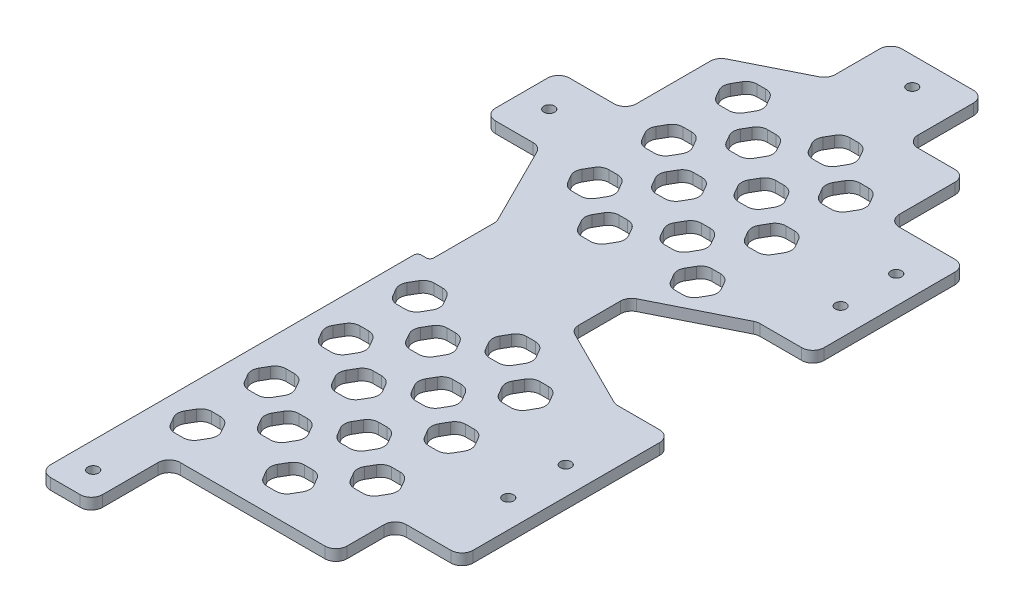
from build123d import *

# Parameters (mm, degrees)
EXTRUDE_1_DEPTH     = 3
FILLET_1_R          = 3
FILLET_2_R          = 1
SKETCH_2_R          = 1.45
CUT_EXTRUDE_1_DEPTH = 119.660324035
CUT_EXTRUDE_2_DEPTH = 119.660324035
FILLET_3_R          = 3


with BuildPart() as part:
    # 草图1 → 凸台-拉伸1 (new body)
    with BuildSketch(Plane(origin=(0, 0, 0), x_dir=(1, 0, 0), z_dir=(0, 1, 0))):
        Polygon((50.15, 65.5), (29.15, 65.5), (29.15, 86.5), (13.15, 86.5), (13.15, 107.5), (-12.15, 107.5), (-12.15, 90.645898034), (-32.15, 80.645898034), (-32.15, 55.854101966), (-50.15, 55.854101966), (-50.15, 35.854101966), (-35.15, 35.854101966), (-23.472949017, 12.5), (-23.472949017, -5.5), (-26.85, -5.5), (-26.85, -107.5), (-12.85, -107.5), (-12.85, -86.5), (32.15, -86.5), (32.15, -70.5), (50.15, -70.5), (50.15, -14.177050983), (35.15, -14.177050983), (11.795898034, -2.5), (11.795898034, 12.5), (35.15, 24.177050983), (50.15, 24.177050983), align=None)
    extrude(amount=EXTRUDE_1_DEPTH)

    # 圆角1
    fillet_1_edges = [part.edges().sort_by_distance(p)[0] for p in [
        (32.15, 1.5, 70.5),
        (-12.85, 1.5, 86.5),
        (-12.85, 1.5, 107.5),
        (-26.85, 1.5, 107.5),
        (-23.472949017, 1.5, -12.5),
        (-35.15, 1.5, -35.854101966),
        (-50.15, 1.5, -35.854101966),
        (-50.15, 1.5, -55.854101966),
        (-12.15, 1.5, -107.5),
        (13.15, 1.5, -107.5),
        (50.15, 1.5, -24.177050983),
        (35.15, 1.5, -24.177050983),
        (11.795898034, 1.5, -12.5),
        (11.795898034, 1.5, 2.5),
        (35.15, 1.5, 14.177050983),
        (50.15, 1.5, 14.177050983),
        (32.15, 1.5, 86.5),
        (50.15, 1.5, 70.5),
        (29.15, 1.5, -86.5),
        (50.15, 1.5, -65.5),
        (-32.15, 1.5, -55.854101966),
        (-32.15, 1.5, -80.645898034),
        (-12.15, 1.5, -90.645898034),
        (13.15, 1.5, -86.5),
        (29.15, 1.5, -65.5),
    ]]
    fillet(fillet_1_edges, radius=FILLET_1_R)

    # 圆角2
    fillet_2_edges = [part.edges().sort_by_distance(p)[0] for p in [
        (-26.85, 1.5, 5.5),
        (-23.472949017, 1.5, 5.5),
    ]]
    fillet(fillet_2_edges, radius=FILLET_2_R)

    # 草图2 → 切除-拉伸1 (cut, through all)
    with BuildSketch(Plane(origin=(0, 3, 0), x_dir=(1, 0, 0), z_dir=(0, 1, 0))):
        with Locations((-19.85, -100)):
            Circle(SKETCH_2_R)
        with Locations((42.65, -50.5)):
            Circle(SKETCH_2_R)
        with Locations((42.65, -35)):
            Circle(SKETCH_2_R)
        with Locations((-42.65, 45.854101966)):
            Circle(SKETCH_2_R)
        with Locations((1.15, 100)):
            Circle(SKETCH_2_R)
        with Locations((42.65, 54.177050983)):
            Circle(SKETCH_2_R)
        with Locations((42.65, 39.177050983)):
            Circle(SKETCH_2_R)
    extrude(amount=-CUT_EXTRUDE_1_DEPTH, mode=Mode.SUBTRACT)

    # 草图3 → 切除-拉伸2 (cut, through all)
    with BuildSketch(Plane(origin=(0, 3, 0), x_dir=(1, 0, 0), z_dir=(0, 1, 0))):
        Polygon((11.483563166, 74.742867255), (8.59681182, 79.742867255), (2.823309128, 79.742867255), (-0.063442218, 74.742867255), (2.823309128, 69.742867255), (8.59681182, 69.742867255), align=None)
        Polygon((-13.516436834, 74.742867255), (-16.40318818, 79.742867255), (-22.176690872, 79.742867255), (-25.063442218, 74.742867255), (-22.176690872, 69.742867255), (-16.40318818, 69.742867255), align=None)
        Polygon((-1.526973427, 65.509227032), (-4.413724773, 70.509227032), (-10.187227465, 70.509227032), (-13.073978811, 65.509227032), (-10.187227465, 60.509227032), (-4.413724773, 60.509227032), align=None)
        Polygon((23.473026573, 65.509227032), (20.586275227, 70.509227032), (14.812772535, 70.509227032), (11.926021189, 65.509227032), (14.812772535, 60.509227032), (20.586275227, 60.509227032), align=None)
        Polygon((11.483563166, 54.742867255), (8.59681182, 59.742867255), (2.823309128, 59.742867255), (-0.063442218, 54.742867255), (2.823309128, 49.742867255), (8.59681182, 49.742867255), align=None)
        Polygon((23.473026573, 45.509227032), (20.586275227, 50.509227032), (14.812772535, 50.509227032), (11.926021189, 45.509227032), (14.812772535, 40.509227032), (20.586275227, 40.509227032), align=None)
        Polygon((11.483563166, 34.742867255), (8.59681182, 39.742867255), (2.823309128, 39.742867255), (-0.063442218, 34.742867255), (2.823309128, 29.742867255), (8.59681182, 29.742867255), align=None)
        Polygon((23.473026573, 25.509227032), (20.586275227, 30.509227032), (14.812772535, 30.509227032), (11.926021189, 25.509227032), (14.812772535, 20.509227032), (20.586275227, 20.509227032), align=None)
        Polygon((-13.516436834, 54.742867255), (-16.40318818, 59.742867255), (-22.176690872, 59.742867255), (-25.063442218, 54.742867255), (-22.176690872, 49.742867255), (-16.40318818, 49.742867255), align=None)
        Polygon((-1.526973427, 45.509227032), (-4.413724773, 50.509227032), (-10.187227465, 50.509227032), (-13.073978811, 45.509227032), (-10.187227465, 40.509227032), (-4.413724773, 40.509227032), align=None)
        Polygon((-13.516436834, 34.742867255), (-16.40318818, 39.742867255), (-22.176690872, 39.742867255), (-25.063442218, 34.742867255), (-22.176690872, 29.742867255), (-16.40318818, 29.742867255), align=None)
        Polygon((-1.526973427, 25.509227032), (-4.413724773, 30.509227032), (-10.187227465, 30.509227032), (-13.073978811, 25.509227032), (-10.187227465, 20.509227032), (-4.413724773, 20.509227032), align=None)
        Polygon((14.370314512, -15.323432531), (11.483563166, -10.323432531), (5.710060474, -10.323432531), (2.823309128, -15.323432531), (5.710060474, -20.323432531), (11.483563166, -20.323432531), align=None)
        Polygon((-10.629685488, -15.323432531), (-13.516436834, -10.323432531), (-19.289939526, -10.323432531), (-22.176690872, -15.323432531), (-19.289939526, -20.323432531), (-13.516436834, -20.323432531), align=None)
        Polygon((1.647855525, -24.058107703), (-1.238895821, -19.058107703), (-7.012398512, -19.058107703), (-9.899149858, -24.058107703), (-7.012398512, -29.058107703), (-1.238895821, -29.058107703), align=None)
        Polygon((26.647855525, -24.058107703), (23.761104179, -19.058107703), (17.987601488, -19.058107703), (15.100850142, -24.058107703), (17.987601488, -29.058107703), (23.761104179, -29.058107703), align=None)
        Polygon((14.370314512, -35.323432531), (11.483563166, -30.323432531), (5.710060474, -30.323432531), (2.823309128, -35.323432531), (5.710060474, -40.323432531), (11.483563166, -40.323432531), align=None)
        Polygon((26.647855525, -44.058107703), (23.761104179, -39.058107703), (17.987601488, -39.058107703), (15.100850142, -44.058107703), (17.987601488, -49.058107703), (23.761104179, -49.058107703), align=None)
        Polygon((14.370314512, -55.323432531), (11.483563166, -50.323432531), (5.710060474, -50.323432531), (2.823309128, -55.323432531), (5.710060474, -60.323432531), (11.483563166, -60.323432531), align=None)
        Polygon((26.647855525, -64.058107703), (23.761104179, -59.058107703), (17.987601488, -59.058107703), (15.100850142, -64.058107703), (17.987601488, -69.058107703), (23.761104179, -69.058107703), align=None)
        Polygon((14.370314512, -75.323432531), (11.483563166, -70.323432531), (5.710060474, -70.323432531), (2.823309128, -75.323432531), (5.710060474, -80.323432531), (11.483563166, -80.323432531), align=None)
        Polygon((-10.629685488, -35.323432531), (-13.516436834, -30.323432531), (-19.289939526, -30.323432531), (-22.176690872, -35.323432531), (-19.289939526, -40.323432531), (-13.516436834, -40.323432531), align=None)
        Polygon((1.647855525, -44.058107703), (-1.238895821, -39.058107703), (-7.012398512, -39.058107703), (-9.899149858, -44.058107703), (-7.012398512, -49.058107703), (-1.238895821, -49.058107703), align=None)
        Polygon((-10.629685488, -55.323432531), (-13.516436834, -50.323432531), (-19.289939526, -50.323432531), (-22.176690872, -55.323432531), (-19.289939526, -60.323432531), (-13.516436834, -60.323432531), align=None)
        Polygon((1.647855525, -64.058107703), (-1.238895821, -59.058107703), (-7.012398512, -59.058107703), (-9.899149858, -64.058107703), (-7.012398512, -69.058107703), (-1.238895821, -69.058107703), align=None)
        Polygon((-10.629685488, -75.323432531), (-13.516436834, -70.323432531), (-19.289939526, -70.323432531), (-22.176690872, -75.323432531), (-19.289939526, -80.323432531), (-13.516436834, -80.323432531), align=None)
    extrude(amount=-CUT_EXTRUDE_2_DEPTH, mode=Mode.SUBTRACT)

    # 圆角3
    fillet_3_edges = [part.edges().sort_by_distance(p)[0] for p in [
        (-22.176690872, 1.5, -69.742867255),
        (-25.063442218, 1.5, -74.742867255),
        (-22.176690872, 1.5, -79.742867255),
        (-16.40318818, 1.5, -79.742867255),
        (-13.516436834, 1.5, -74.742867255),
        (-16.40318818, 1.5, -69.742867255),
        (5.710060474, 1.5, 80.323432531),
        (2.823309128, 1.5, 75.323432531),
        (5.710060474, 1.5, 70.323432531),
        (11.483563166, 1.5, 70.323432531),
        (14.370314512, 1.5, 75.323432531),
        (11.483563166, 1.5, 80.323432531),
        (17.987601488, 1.5, 69.058107703),
        (15.100850142, 1.5, 64.058107703),
        (17.987601488, 1.5, 59.058107703),
        (23.761104179, 1.5, 59.058107703),
        (26.647855525, 1.5, 64.058107703),
        (23.761104179, 1.5, 69.058107703),
        (5.710060474, 1.5, 60.323432531),
        (2.823309128, 1.5, 55.323432531),
        (5.710060474, 1.5, 50.323432531),
        (11.483563166, 1.5, 50.323432531),
        (14.370314512, 1.5, 55.323432531),
        (11.483563166, 1.5, 60.323432531),
        (17.987601488, 1.5, 49.058107703),
        (15.100850142, 1.5, 44.058107703),
        (17.987601488, 1.5, 39.058107703),
        (23.761104179, 1.5, 39.058107703),
        (26.647855525, 1.5, 44.058107703),
        (23.761104179, 1.5, 49.058107703),
        (-19.289939526, 1.5, 40.323432531),
        (-22.176690872, 1.5, 35.323432531),
        (-19.289939526, 1.5, 30.323432531),
        (-13.516436834, 1.5, 30.323432531),
        (-10.629685488, 1.5, 35.323432531),
        (-13.516436834, 1.5, 40.323432531),
        (-7.012398512, 1.5, 49.058107703),
        (-9.899149858, 1.5, 44.058107703),
        (-7.012398512, 1.5, 39.058107703),
        (-1.238895821, 1.5, 39.058107703),
        (1.647855525, 1.5, 44.058107703),
        (-1.238895821, 1.5, 49.058107703),
        (-19.289939526, 1.5, 60.323432531),
        (-22.176690872, 1.5, 55.323432531),
        (-19.289939526, 1.5, 50.323432531),
        (-13.516436834, 1.5, 50.323432531),
        (-10.629685488, 1.5, 55.323432531),
        (-13.516436834, 1.5, 60.323432531),
        (-7.012398512, 1.5, 69.058107703),
        (-9.899149858, 1.5, 64.058107703),
        (-7.012398512, 1.5, 59.058107703),
        (-1.238895821, 1.5, 59.058107703),
        (1.647855525, 1.5, 64.058107703),
        (-1.238895821, 1.5, 69.058107703),
        (-19.289939526, 1.5, 80.323432531),
        (-22.176690872, 1.5, 75.323432531),
        (-19.289939526, 1.5, 70.323432531),
        (-13.516436834, 1.5, 70.323432531),
        (-10.629685488, 1.5, 75.323432531),
        (-13.516436834, 1.5, 80.323432531),
        (14.812772535, 1.5, -20.509227032),
        (11.926021189, 1.5, -25.509227032),
        (14.812772535, 1.5, -30.509227032),
        (20.586275227, 1.5, -30.509227032),
        (23.473026573, 1.5, -25.509227032),
        (20.586275227, 1.5, -20.509227032),
        (2.823309128, 1.5, -29.742867255),
        (-0.063442218, 1.5, -34.742867255),
        (2.823309128, 1.5, -39.742867255),
        (8.59681182, 1.5, -39.742867255),
        (11.483563166, 1.5, -34.742867255),
        (8.59681182, 1.5, -29.742867255),
        (14.812772535, 1.5, -40.509227032),
        (11.926021189, 1.5, -45.509227032),
        (14.812772535, 1.5, -50.509227032),
        (20.586275227, 1.5, -50.509227032),
        (23.473026573, 1.5, -45.509227032),
        (20.586275227, 1.5, -40.509227032),
        (2.823309128, 1.5, -49.742867255),
        (-0.063442218, 1.5, -54.742867255),
        (2.823309128, 1.5, -59.742867255),
        (8.59681182, 1.5, -59.742867255),
        (11.483563166, 1.5, -54.742867255),
        (8.59681182, 1.5, -49.742867255),
        (-10.187227465, 1.5, -60.509227032),
        (-13.073978811, 1.5, -65.509227032),
        (-10.187227465, 1.5, -70.509227032),
        (-4.413724773, 1.5, -70.509227032),
        (-1.526973427, 1.5, -65.509227032),
        (-4.413724773, 1.5, -60.509227032),
        (2.823309128, 1.5, -69.742867255),
        (-0.063442218, 1.5, -74.742867255),
        (2.823309128, 1.5, -79.742867255),
        (11.483563166, 1.5, -74.742867255),
        (8.59681182, 1.5, -69.742867255),
        (-19.289939526, 1.5, 20.323432531),
        (-22.176690872, 1.5, 15.323432531),
        (-19.289939526, 1.5, 10.323432531),
        (-13.516436834, 1.5, 10.323432531),
        (-10.629685488, 1.5, 15.323432531),
        (-13.516436834, 1.5, 20.323432531),
        (14.812772535, 1.5, -60.509227032),
        (11.926021189, 1.5, -65.509227032),
        (14.812772535, 1.5, -70.509227032),
        (23.473026573, 1.5, -65.509227032),
        (20.586275227, 1.5, -60.509227032),
        (-22.176690872, 1.5, -49.742867255),
        (-25.063442218, 1.5, -54.742867255),
        (-22.176690872, 1.5, -59.742867255),
        (-16.40318818, 1.5, -59.742867255),
        (-13.516436834, 1.5, -54.742867255),
        (-16.40318818, 1.5, -49.742867255),
        (-10.187227465, 1.5, -40.509227032),
        (-13.073978811, 1.5, -45.509227032),
        (-10.187227465, 1.5, -50.509227032),
        (-4.413724773, 1.5, -50.509227032),
        (-1.526973427, 1.5, -45.509227032),
        (-4.413724773, 1.5, -40.509227032),
        (-22.176690872, 1.5, -29.742867255),
        (-25.063442218, 1.5, -34.742867255),
        (-22.176690872, 1.5, -39.742867255),
        (-16.40318818, 1.5, -39.742867255),
        (-13.516436834, 1.5, -34.742867255),
        (-16.40318818, 1.5, -29.742867255),
        (-10.187227465, 1.5, -20.509227032),
        (-13.073978811, 1.5, -25.509227032),
        (-10.187227465, 1.5, -30.509227032),
        (-4.413724773, 1.5, -30.509227032),
        (-1.526973427, 1.5, -25.509227032),
        (-4.413724773, 1.5, -20.509227032),
        (5.710060474, 1.5, 40.323432531),
        (2.823309128, 1.5, 35.323432531),
        (5.710060474, 1.5, 30.323432531),
        (11.483563166, 1.5, 30.323432531),
        (14.370314512, 1.5, 35.323432531),
        (11.483563166, 1.5, 40.323432531),
        (17.987601488, 1.5, 29.058107703),
        (15.100850142, 1.5, 24.058107703),
        (17.987601488, 1.5, 19.058107703),
        (23.761104179, 1.5, 19.058107703),
        (26.647855525, 1.5, 24.058107703),
        (23.761104179, 1.5, 29.058107703),
        (5.710060474, 1.5, 20.323432531),
        (2.823309128, 1.5, 15.323432531),
        (5.710060474, 1.5, 10.323432531),
        (11.483563166, 1.5, 10.323432531),
        (14.370314512, 1.5, 15.323432531),
        (11.483563166, 1.5, 20.323432531),
        (-7.012398512, 1.5, 29.058107703),
        (-9.899149858, 1.5, 24.058107703),
        (-7.012398512, 1.5, 19.058107703),
        (-1.238895821, 1.5, 19.058107703),
        (1.647855525, 1.5, 24.058107703),
        (-1.238895821, 1.5, 29.058107703),
        (20.586275227, 1.5, -70.509227032),
        (8.59681182, 1.5, -79.742867255),
    ]]
    fillet(fillet_3_edges, radius=FILLET_3_R)


solid = part.part
